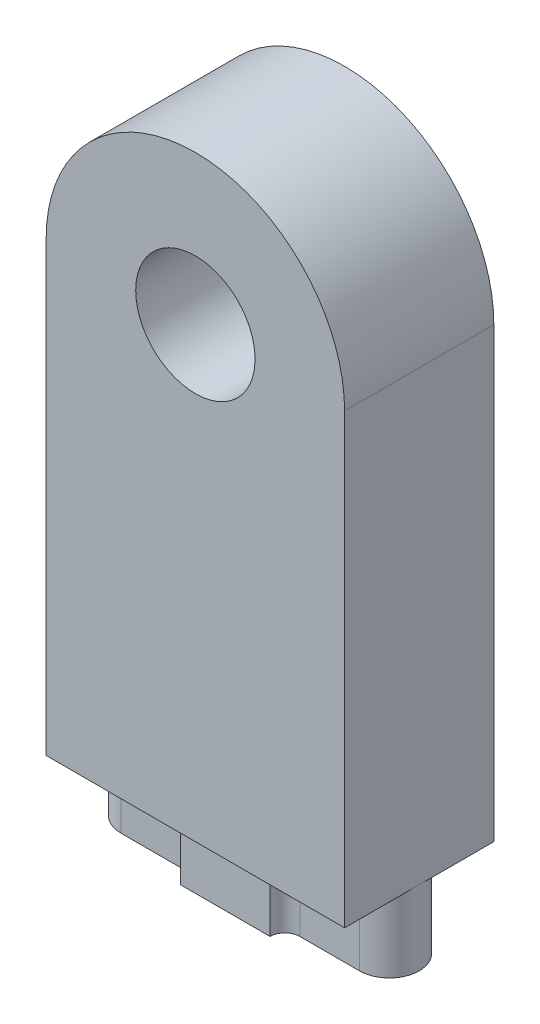
from build123d import *

# Parameters (mm, degrees)
BOSS_EXTRUDE1_DEPTH = 10
SKETCH2_R           = 4
CUT_EXTRUDE1_DEPTH  = 10
BOSS_EXTRUDE2_DEPTH = 5
BOSS_EXTRUDE3_DEPTH = 5
FILLET1_R           = 1


with BuildPart() as part:
    # Sketch1 → Boss-Extrude1 (new body)
    with BuildSketch(Plane.XY):
        with BuildLine():
            Line((-10, -20), (10, -20))
            Line((10, -20), (10, 10))
            ThreePointArc((10, 10), (0, 20), (-10, 10))
            Line((-10, 10), (-10, -20))
        make_face()
    extrude(amount=BOSS_EXTRUDE1_DEPTH)

    # Sketch2 → Cut-Extrude1 (cut)
    with BuildSketch(Plane(origin=(0, 0, 0), x_dir=(-1, 0, 0), z_dir=(0, 0, -1))):
        with Locations((0, 10)):
            Circle(SKETCH2_R)
    extrude(amount=-CUT_EXTRUDE1_DEPTH, mode=Mode.SUBTRACT)

    # Sketch3 → Boss-Extrude2 (add)
    with BuildSketch(Plane.XZ.offset(20)):
        with BuildLine():
            Line((-8, 7), (8, 7))
            ThreePointArc((8, 7), (10, 5), (8, 3))
            Line((8, 3), (-8, 3))
            ThreePointArc((-8, 3), (-10, 5), (-8, 7))
        make_face()
    extrude(amount=BOSS_EXTRUDE2_DEPTH)

    # Sketch4 → Boss-Extrude3 (add)
    with BuildSketch(Plane.XZ.offset(20)):
        Polygon((-1.75, 8), (1.75, 8), (3, 8), (3, 6.75), (3, 3.25), (3, 2), (1.75, 2), (-1.75, 2), (-3, 2), (-3, 3.25), (-3, 6.75), (-3, 8), align=None)
    extrude(amount=BOSS_EXTRUDE3_DEPTH)

    # Fillet1
    fillet1_edges = [part.edges().sort_by_distance(p)[0] for p in [
        (3, -22.5, 7),
        (3, -22.5, 3),
        (-3, -22.5, 3),
        (-3, -22.5, 7),
    ]]
    fillet(fillet1_edges, radius=FILLET1_R - 0.0001)  # a hair under: the kernel refuses the full size


solid = part.part
